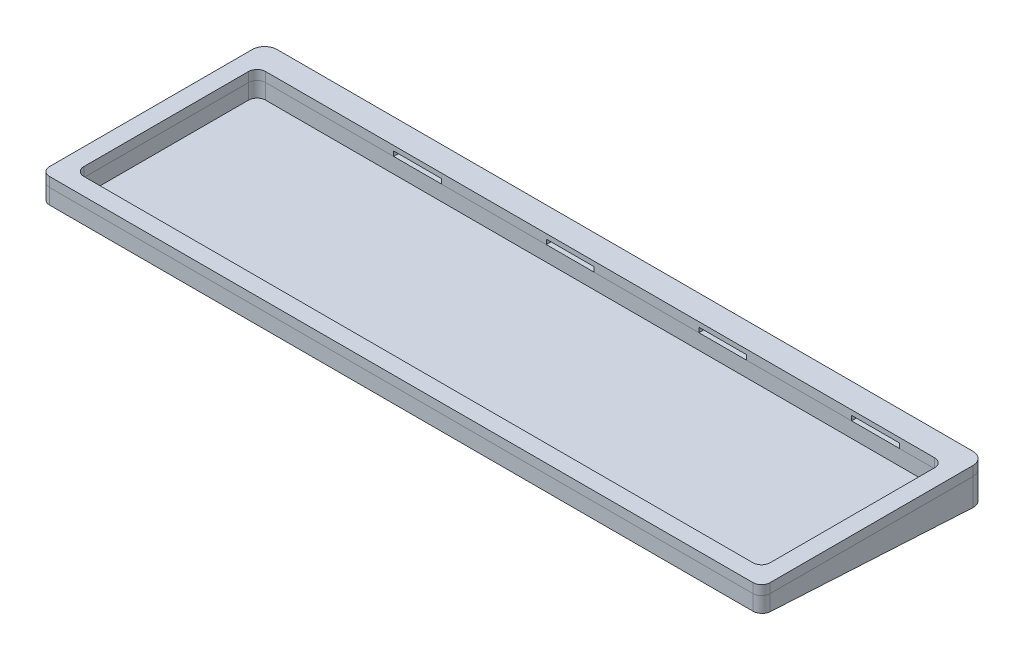
from build123d import *

# Parameters (mm, degrees)
BOSS_EXTRUDE1_DEPTH = 13
SKETCH4_W           = 377.65
SKETCH4_H           = 117.25
BOSS_EXTRUDE3_DEPTH = 10.5
CUT_EXTRUDE3_DEPTH  = 400
FILLET1_R           = 6.5
FILLET4_R           = 4.5
FILLET2_R           = 4.5
SKETCH10_W          = 25
SKETCH10_H          = 7
SKETCH10_H_2        = 7.5
CUT_EXTRUDE2_DEPTH  = 2.5
FILLET3_R           = 4.5


with BuildPart() as part:
    # Sketch2 → Boss-Extrude1 (new body)
    with BuildSketch(Plane(origin=(0, 0, 0), x_dir=(1, 0, 0), z_dir=(0, 1, 0))):
        Polygon((-188.825, 60.625), (-188.825, 54.625), (-188.825, -56.625), (188.825, -56.625), (188.825, 60.625), (-182.825, 60.625), align=None)
        Polygon((-179.825, -46.625), (-179.825, 46.625), (-179.825, 47.625), (-178.825, 47.625), (178.825, 47.625), (179.825, 47.625), (179.825, 46.625), (179.825, -46.625), (179.825, -47.625), (178.825, -47.625), (-178.825, -47.625), (-179.825, -47.625), align=None, mode=Mode.SUBTRACT)
    extrude(amount=BOSS_EXTRUDE1_DEPTH)

    # Sketch4 → Boss-Extrude3 (add)
    with BuildSketch(Plane.XZ):
        with Locations((0, -2)):
            Rectangle(SKETCH4_W, SKETCH4_H)
    extrude(amount=BOSS_EXTRUDE3_DEPTH)

    # Sketch12 → Cut-Extrude3 (cut)
    with BuildSketch(Plane.ZY.offset(188.825)):
        Polygon((-60.625, -10.5), (-60.625, -6.5), (56.625, 0), (56.625, -10.5), align=None)
    extrude(amount=-CUT_EXTRUDE3_DEPTH, mode=Mode.SUBTRACT)

    # Fillet1
    fillet1_edges = [part.edges().sort_by_distance(p)[0] for p in [
        (188.825, 3.25, -60.625),
        (-188.825, 3.25, -60.625),
    ]]
    fillet(fillet1_edges, radius=FILLET1_R)

    # Fillet4
    fillet4_edges = [part.edges().sort_by_distance(p)[0] for p in [
        (188.825, 6.5, 56.625),
        (-188.825, 6.5, 56.625),
    ]]
    fillet(fillet4_edges, radius=FILLET4_R)

    # Fillet2
    fillet2_edges = [part.edges().sort_by_distance(p)[0] for p in [
        (179.825, 6.5, 47.625),
        (-179.825, 6.5, 47.625),
        (179.825, 6.5, -47.625),
        (-179.825, 6.5, -47.625),
    ]]
    fillet(fillet2_edges, radius=FILLET2_R)


with BuildPart() as body_2:
    # Split1: the piece on the far side of the plane
    add(part.part)
    split(bisect_by=Plane.ZX.offset(8), keep=Keep.BOTTOM)


with BuildPart() as part_1:
    add(part.part)

    # Split1
    split(bisect_by=Plane.ZX.offset(8), keep=Keep.TOP)

    # Sketch10 → Cut-Extrude2 (cut)
    with BuildSketch(Plane(origin=(0, 8, 0), x_dir=(1, 0, 0), z_dir=(0, 1, 0))):
        Polygon((-108.245613046, 55.125), (-108.245613046, 47.625), (-83.245613046, 47.625), (-83.245613046, 55.125), (-90.245613046, 55.125), align=None)
        with Locations((-93.199035781, -51.125)):
            Rectangle(SKETCH10_W, SKETCH10_H)
        with Locations((-15.745613046, 51.375)):
            Rectangle(SKETCH10_W, SKETCH10_H_2)
        with Locations((-13.199035781, -51.125)):
            Rectangle(SKETCH10_W, SKETCH10_H)
        with Locations((64.254386954, 51.375)):
            Rectangle(SKETCH10_W, SKETCH10_H_2)
        with Locations((66.800964219, -51.125)):
            Rectangle(SKETCH10_W, SKETCH10_H)
        with Locations((144.254386954, 51.375)):
            Rectangle(SKETCH10_W, SKETCH10_H_2)
        with Locations((146.800964219, -51.125)):
            Rectangle(SKETCH10_W, SKETCH10_H)
    extrude(amount=CUT_EXTRUDE2_DEPTH, mode=Mode.SUBTRACT)

    # Fillet3
    fillet3_edges = [part_1.edges().sort_by_distance(p)[0] for p in [
        (-108.245613046, 9.25, -55.125),
        (-28.245613046, 9.25, -55.125),
        (-3.245613046, 9.25, -55.125),
        (-83.245613046, 9.25, -55.125),
        (76.754386954, 9.25, -55.125),
        (51.754386954, 9.25, -55.125),
        (131.754386954, 9.25, -55.125),
        (156.754386954, 9.25, -55.125),
        (134.300964219, 9.25, 54.625),
        (159.300964219, 9.25, 54.625),
        (79.300964219, 9.25, 54.625),
        (54.300964219, 9.25, 54.625),
        (-25.699035781, 9.25, 54.625),
        (-0.699035781, 9.25, 54.625),
        (-80.699035781, 9.25, 54.625),
        (-105.699035781, 9.25, 54.625),
    ]]
    fillet(fillet3_edges, radius=FILLET3_R)


solid = Compound([body_2.part, part_1.part])
